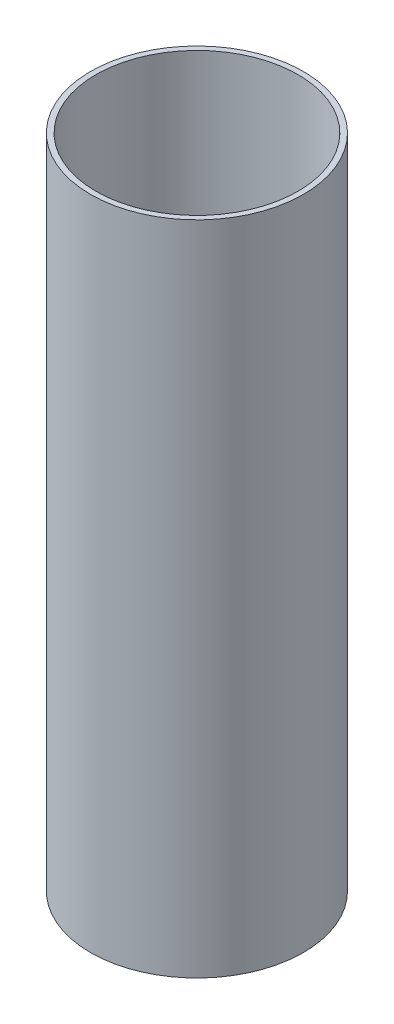
from build123d import *

# Parameters (mm, degrees)
SKETCH1_R           = 93.6625
SKETCH1_R_2         = 88.9
BOSS_EXTRUDE1_DEPTH = 288.798


with BuildPart() as part:
    # Sketch1 → Boss-Extrude1 (new, symmetric)
    with BuildSketch(Plane(origin=(0, 0, 0), x_dir=(1, 0, 0), z_dir=(0, 1, 0))):
        Circle(SKETCH1_R)
        Circle(SKETCH1_R_2, mode=Mode.SUBTRACT)
    extrude(amount=BOSS_EXTRUDE1_DEPTH, both=True)


solid = part.part
